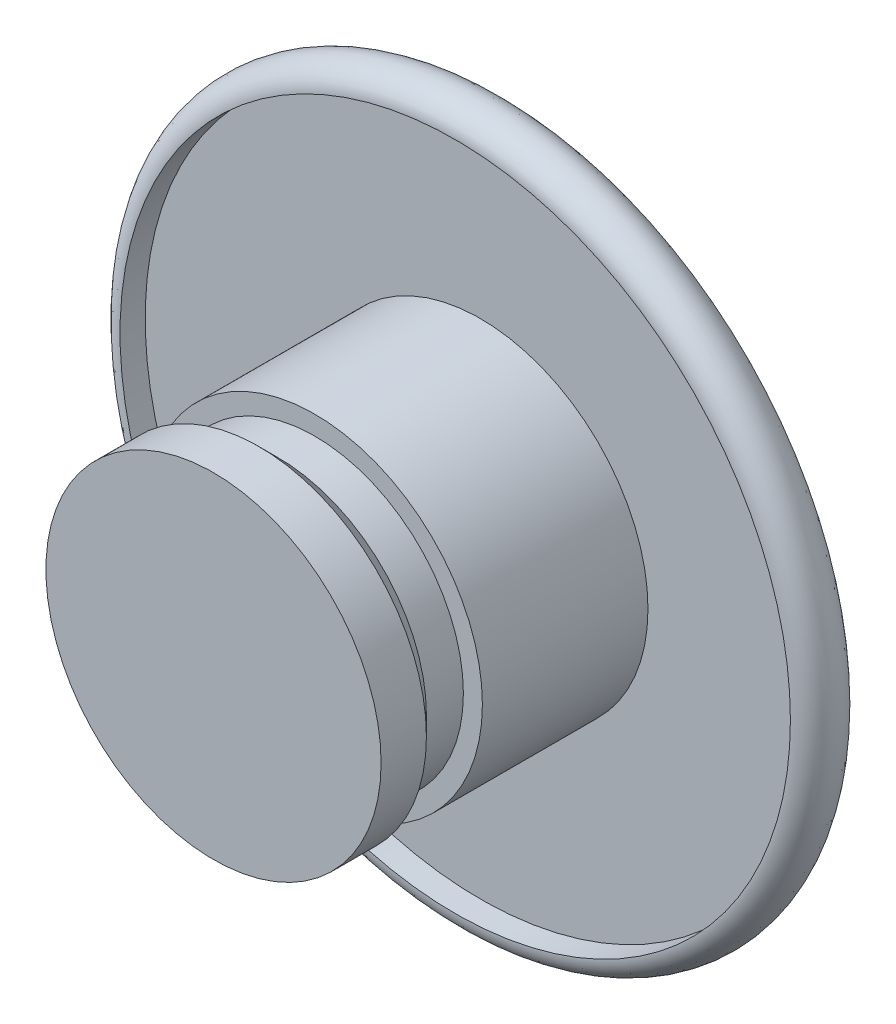
from build123d import *

# Parameters (mm, degrees)
SKETCH1_W     = 3.309352518
SKETCH1_H     = 13.3
CHAMFER1_SIZE = 1.7


with BuildPart() as part:
    # Sketch1 → Revolve1 (revolve)
    with BuildSketch(Plane(origin=(0, 0, 0), x_dir=(0, 0, -1), z_dir=(1, 0, 0)), mode=Mode.PRIVATE) as revolve1_sk:
        Polygon((23.884892086, 15), (23.884892086, 30), (9.064748201, 30), (9.064748201, 28.3), (9.064748201, 15), align=None)
        with BuildLine():
            add(Edge.make_bspline(
                [(26.136310791, 45), (26.136310791, 47.087884729), (23.884892086, 47.087884729), (21.633473381, 47.087884729), (21.633473381, 45)],
                knots=[0, 0, 0, 1.570796327, 1.570796327, 3.141592654, 3.141592654, 3.141592654], degree=2, weights=[1, 0.707106781, 1, 0.707106781, 1]))
            Line((21.633473381, 45), (23.884892086, 45))
            Line((23.884892086, 45), (23.884892086, 30))
            Line((23.884892086, 30), (23.884892086, 15))
            Line((23.884892086, 15), (26.136310791, 15))
            Line((26.136310791, 15), (26.136310791, 45))
        make_face()
        Polygon((5.755395683, 15), (5.755395683, 28.3), (5.755395683, 30), (0, 30), (0, 15), align=None)
        with Locations((7.410071942, 21.65)):
            Rectangle(SKETCH1_W, SKETCH1_H)
    revolve(revolve1_sk.sketch.rotate(Axis((0, 15, 10.547508617), (0, 0, -1)), 90), axis=Axis((0, 15, 10.547508617), (0, 0, -1)))

    # Chamfer1
    chamfer1_edges = [part.edges().sort_by_distance(p)[0] for p in [
        (-15, 15, -5.755395683),
    ]]
    chamfer(chamfer1_edges, length=CHAMFER1_SIZE - 0.0001)  # a hair under: the kernel refuses the full size


solid = part.part
